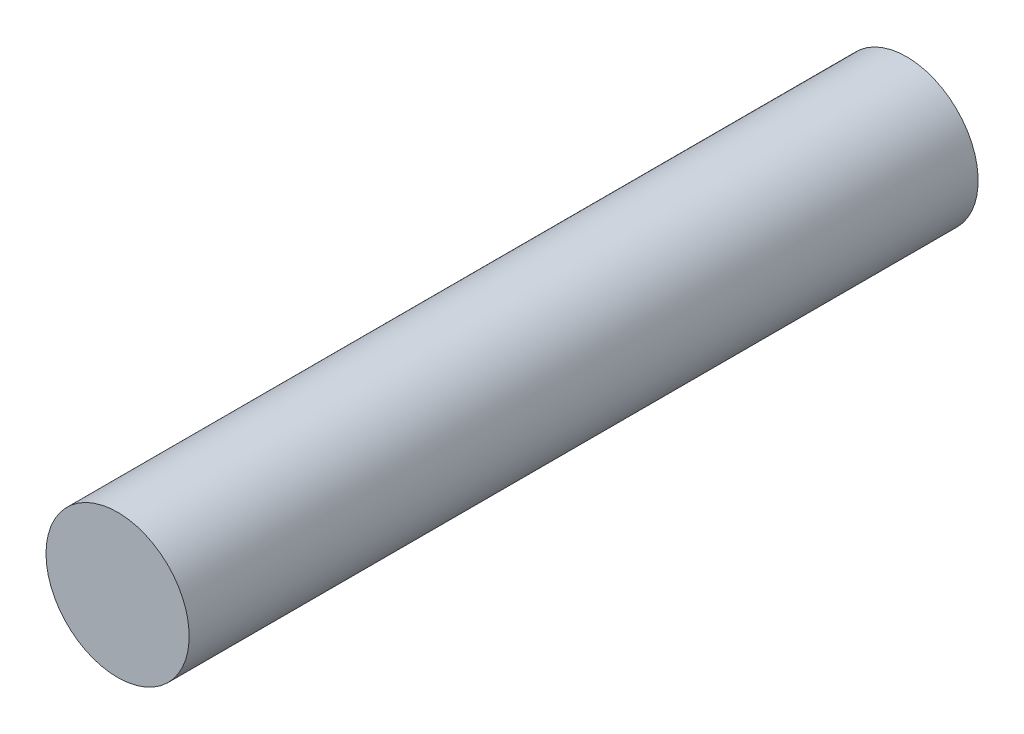
from build123d import *

# Parameters (mm, degrees)
SKETCH1_R           = 4.5
BOSS_EXTRUDE1_DEPTH = 49.6


with BuildPart() as part:
    # Sketch1 → Boss-Extrude1 (new body)
    with BuildSketch(Plane.XY):
        Circle(SKETCH1_R)
    extrude(amount=BOSS_EXTRUDE1_DEPTH)


solid = part.part
